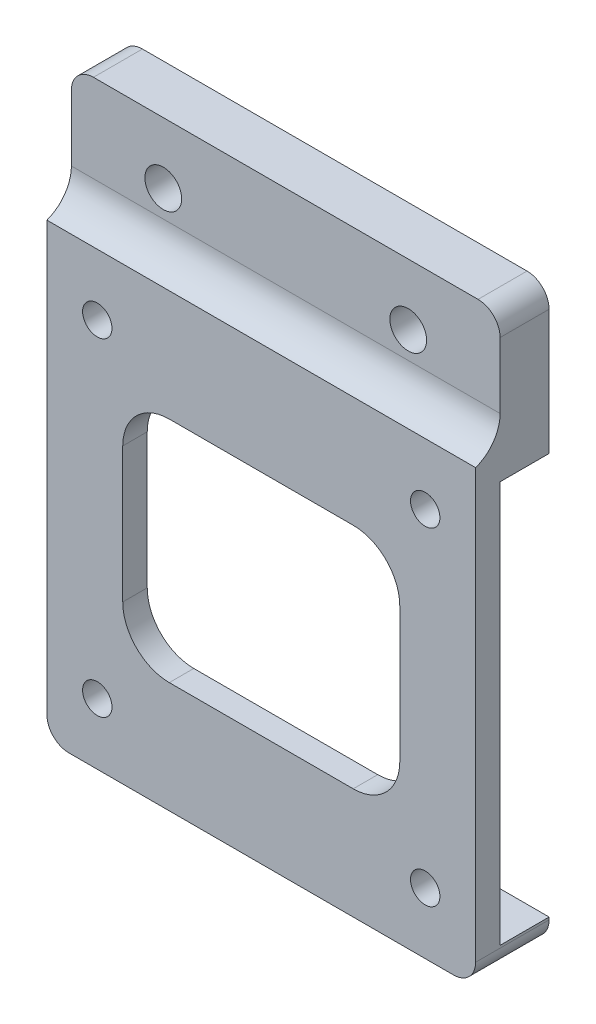
from build123d import *

# Parameters (mm, degrees)
SKETCH1_W           = 44.45
SKETCH1_H           = 59.4
SKETCH1_R           = 1.905
SKETCH1_R_2         = 1.524
BOSS_EXTRUDE1_DEPTH = 5.08
SKETCH2_W           = 44.45
SKETCH2_H           = 46.7
SKETCH2_R           = 1.524
BOSS_EXTRUDE2_DEPTH = 2.54
SKETCH3_W           = 44.45
SKETCH3_H           = 41.62
CUT_EXTRUDE1_DEPTH  = 5.08
FILLET2_R           = 2.286
SKETCH4_W           = 28.72406321
SKETCH4_H           = 23.663865546
CUT_EXTRUDE2_DEPTH  = 64.969700054
FILLET3_R           = 4.826
FILLET4_R           = 3.81


with BuildPart() as part:
    # Sketch1 → Boss-Extrude1 (new body)
    with BuildSketch(Plane.XY):
        with Locations((12.7, -23.35)):
            Rectangle(SKETCH1_W, SKETCH1_H)
        Circle(SKETCH1_R, mode=Mode.SUBTRACT)
        with Locations((25.4, 0)):
            Circle(SKETCH1_R, mode=Mode.SUBTRACT)
        with Locations((-4.3, -12.7)):
            Circle(SKETCH1_R_2, mode=Mode.SUBTRACT)
        with Locations((29.7, -12.7)):
            Circle(SKETCH1_R_2, mode=Mode.SUBTRACT)
        with Locations((29.7, -46.7)):
            Circle(SKETCH1_R_2, mode=Mode.SUBTRACT)
        with Locations((-4.3, -46.7)):
            Circle(SKETCH1_R_2, mode=Mode.SUBTRACT)
    extrude(amount=BOSS_EXTRUDE1_DEPTH)

    # Sketch2 → Boss-Extrude2 (add)
    with BuildSketch(Plane.XY.offset(5.08)):
        with Locations((12.7, -29.7)):
            Rectangle(SKETCH2_W, SKETCH2_H)
        with Locations((-4.3, -12.7)):
            Circle(SKETCH2_R, mode=Mode.SUBTRACT)
        with Locations((-4.3, -46.7)):
            Circle(SKETCH2_R, mode=Mode.SUBTRACT)
        with Locations((29.7, -12.7)):
            Circle(SKETCH2_R, mode=Mode.SUBTRACT)
        with Locations((29.7, -46.7)):
            Circle(SKETCH2_R, mode=Mode.SUBTRACT)
    extrude(amount=BOSS_EXTRUDE2_DEPTH)

    # Sketch3 → Cut-Extrude1 (cut)
    with BuildSketch(Plane(origin=(0, 0, 0), x_dir=(-1, 0, 0), z_dir=(0, 0, -1))):
        with Locations((-12.7, -29.7)):
            Rectangle(SKETCH3_W, SKETCH3_H)
    extrude(amount=-CUT_EXTRUDE1_DEPTH, mode=Mode.SUBTRACT)

    # Fillet2
    fillet2_edges = [part.edges().sort_by_distance(p)[0] for p in [
        (-9.525, 6.35, 2.54),
        (34.925, 6.35, 2.54),
        (34.925, -53.05, 3.81),
        (-9.525, -53.05, 3.81),
    ]]
    fillet(fillet2_edges, radius=FILLET2_R)

    # Sketch4 → Cut-Extrude2 (cut, through all)
    with BuildSketch(Plane.XY.offset(7.62)):
        with Locations((12.7, -29.7)):
            Rectangle(SKETCH4_W, SKETCH4_H)
    extrude(amount=-CUT_EXTRUDE2_DEPTH, mode=Mode.SUBTRACT)

    # Fillet3
    fillet3_edges = [part.edges().sort_by_distance(p)[0] for p in [
        (-1.662031605, -41.531932773, 6.35),
        (-1.662031605, -17.868067227, 6.35),
        (27.062031605, -17.868067227, 6.35),
        (27.062031605, -41.531932773, 6.35),
    ]]
    fillet(fillet3_edges, radius=FILLET3_R)

    # Fillet4
    # the kernel refuses this fillet: 3.81 mm, written as the material it adds along each edge
    with BuildSketch(Plane(origin=(34.925, -6.35, 5.08), x_dir=(0, 0, 1), z_dir=(-1, 0, 0))) as fillet4_piece_1:
        with BuildLine():
            CenterArc((3.81, 3.592102448), FILLET4_R, 180, 70.528779366)
            Line((0, 3.592102448), (-0.0762, 3.592102448))
            Line((-0.0762, 3.592102448), (-0.0762, 0))
            Line((-0.0762, 0), (0, -0.0762))
            ThreePointArc((0, -0.0762), (1.27, -0.0762), (2.5146, -0.071842049))
            Line((2.5146, -0.071842049), (2.54, 0))
        make_face()
    extrude(amount=44.45)


solid = part.part
